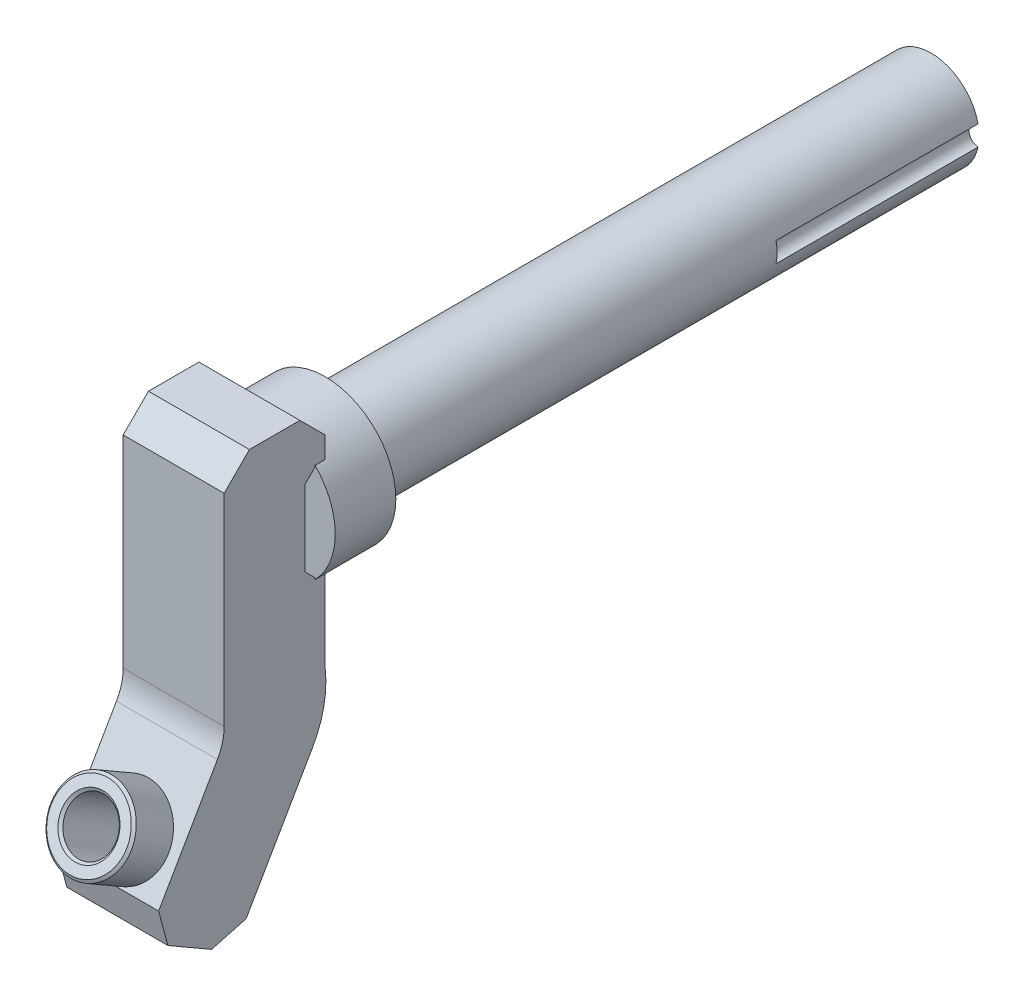
from build123d import *

# Parameters (mm, degrees)
SCHIZZO1_R                   = 9.5
ESTRUSIONE_ESTRUSIONE1_DEPTH = 120
SCHIZZO3_R                   = 14
ESTRUSIONE_ESTRUSIONE2_DEPTH = 12
ESTRUSIONE_ESTRUSIONE5_DEPTH = 10
SCHIZZO5_R                   = 8
ESTRUSIONE_ESTRUSIONE6_DEPTH = 9
SCHIZZO6_R                   = 5
TAGLIO_ESTRUSIONE1_DEPTH     = 168.809094524
SMUSSO4_SIZE                 = 0.5
SMUSSO5_SIZE                 = 5
SMUSSO6_SIZE                 = 2
TAGLIO_ESTRUSIONE2_DEPTH     = 40


with BuildPart() as part:
    # Schizzo1 → Estrusione-Estrusione1 (new body)
    with BuildSketch(Plane.XY):
        Circle(SCHIZZO1_R)
    extrude(amount=ESTRUSIONE_ESTRUSIONE1_DEPTH)

    # Schizzo3 → Estrusione-Estrusione2 (add)
    with BuildSketch(Plane.XY.offset(120)):
        Circle(SCHIZZO3_R)
    extrude(amount=ESTRUSIONE_ESTRUSIONE2_DEPTH)

    # Schizzo4 → Estrusione-Estrusione5 (add, symmetric)
    with BuildSketch(Plane(origin=(0, 0, 0), x_dir=(0, 0, -1), z_dir=(1, 0, 0))):
        with BuildLine():
            Line((-150, 19), (-130, 19))
            Line((-130, 19), (-130, 9.5))
            Line((-130, 9.5), (-134, 9.5))
            Line((-134, 9.5), (-134, -9.5))
            Line((-134, -9.5), (-130, -9.5))
            Line((-130, -9.5), (-130, -26))
            ThreePointArc((-130, -26), (-130.255391155, -32.41801754), (-132.532041772, -38.424100769))
            Line((-132.532041772, -38.424100769), (-148.160907637, -65.494090512))
            Line((-148.160907637, -65.494090512), (-165.481415713, -55.494090512))
            Line((-165.481415713, -55.494090512), (-151.339745962, -31))
            ThreePointArc((-151.339745962, -31), (-150.340741737, -28.588190451), (-150, -26))
            Line((-150, -26), (-150, 19))
        make_face()
    extrude(amount=ESTRUSIONE_ESTRUSIONE5_DEPTH, both=True)

    # Schizzo5 → Estrusione-Estrusione6 (add)
    with BuildSketch(Plane(origin=(0, 57.782032303, 100.081415713), x_dir=(1, 0, 0), z_dir=(0, 0.4999999999999945, 0.8660254037844419))):
        with Locations(Location((0, -117.8, 0), (0, 0, 90))):
            Circle(SCHIZZO5_R)
    extrude(amount=ESTRUSIONE_ESTRUSIONE6_DEPTH)

    # Schizzo6 → Taglio-Estrusione1 (cut, through all)
    with BuildSketch(Plane(origin=(0, 62.282032303, 107.875644347), x_dir=(1, 0, 0), z_dir=(0, 0.49999999999999467, 0.8660254037844417))):
        with Locations(Location((0, -117.8, 0), (0, 0, 270))):
            Circle(SCHIZZO6_R)
    extrude(amount=-TAGLIO_ESTRUSIONE1_DEPTH, mode=Mode.SUBTRACT)

    # Smusso4
    smusso4_edges = [part.edges().sort_by_distance(p)[0] for p in [
        (0, -46.663963493, 170.775644347),
        (0, -49.905633244, 139.160907637),
        (0, -35.405633244, 164.275644347),
    ]]
    chamfer(smusso4_edges, length=SMUSSO4_SIZE)

    # Smusso5
    smusso5_edges = [part.edges().sort_by_distance(p)[0] for p in [
        (0, 19, 150),
        (0, -55.494090512, 165.481415713),
        (0, -65.494090512, 148.160907637),
        (0, 19, 130),
    ]]
    chamfer(smusso5_edges, length=SMUSSO5_SIZE - 0.0001)  # a hair under: the kernel refuses the full size

    # Smusso6
    smusso6_edges = [part.edges().sort_by_distance(p)[0] for p in [
        (0, -9.5, 134),
        (0, 9.5, 134),
    ]]
    chamfer(smusso6_edges, length=SMUSSO6_SIZE - 0.0001)  # a hair under: the kernel refuses the full size

    # Schizzo8 → Taglio-Estrusione2 (cut)
    with BuildSketch(Plane(origin=(0, 0, 0), x_dir=(-1, 0, 0), z_dir=(0, 0, -1))):
        with BuildLine():
            ThreePointArc((-9.289473684, -1.988888803), (-7.5, 0), (-9.289473684, 1.988888803))
            ThreePointArc((-9.289473684, 1.988888803), (-9.5, 0), (-9.289473684, -1.988888803))
        make_face()
    extrude(amount=-TAGLIO_ESTRUSIONE2_DEPTH, mode=Mode.SUBTRACT)


solid = part.part
